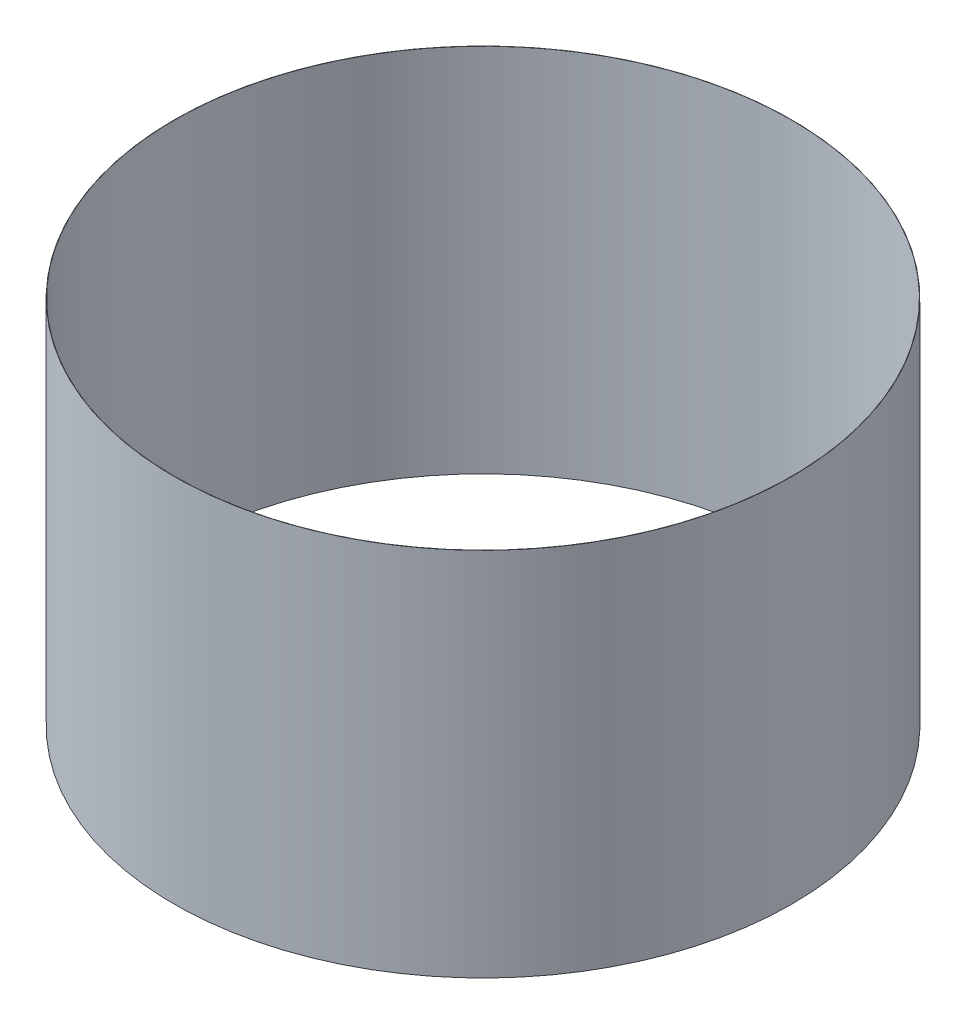
from build123d import *

# Parameters (mm, degrees)
SKETCH1_R           = 125.1
SKETCH1_R_2         = 125
EXTRUDE_THIN1_DEPTH = 150


with BuildPart() as part:
    # Sketch1 → Extrude-Thin1 (new body)
    with BuildSketch(Plane(origin=(0, 0, 0), x_dir=(1, 0, 0), z_dir=(0, 1, 0))):
        Circle(SKETCH1_R)
        Circle(SKETCH1_R_2, mode=Mode.SUBTRACT)
    extrude(amount=EXTRUDE_THIN1_DEPTH)


solid = part.part
